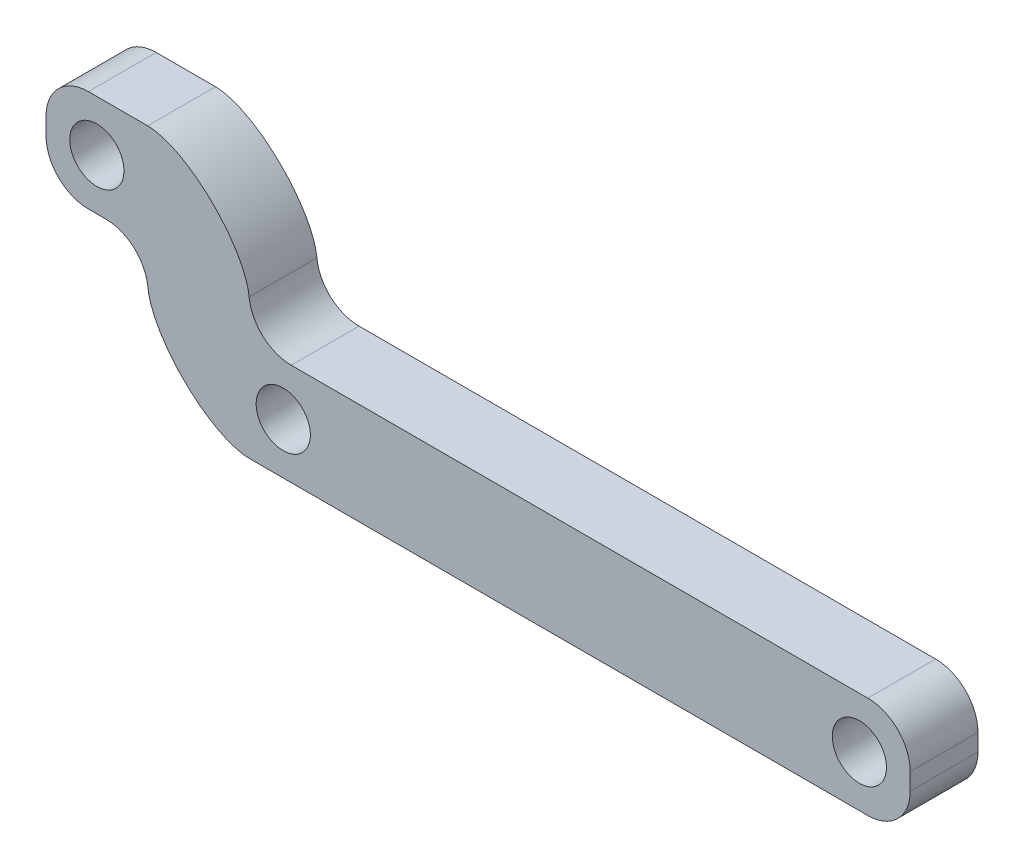
from build123d import *

# Parameters (mm, degrees)
SKETCH1_W           = 45
SKETCH1_H           = 6
SKETCH1_W_2         = 6
BOSS_EXTRUDE1_DEPTH = 4
SKETCH2_R           = 1.6
CUT_EXTRUDE1_DEPTH  = 52.778373864
FILLET2_SIZE        = 6
FILLET3_R           = 2.5


with BuildPart() as part:
    # Sketch1 → Boss-Extrude1 (new body)
    with BuildSketch(Plane.XY):
        with Locations((-22.5, -3)):
            Rectangle(SKETCH1_W, SKETCH1_H)
        Polygon((-45, 0), (-39, 0), (-39, 8), (-45, 8), (-45, 2), align=None)
        with Locations((-48, 5)):
            Rectangle(SKETCH1_W_2, SKETCH1_H)
    extrude(amount=BOSS_EXTRUDE1_DEPTH)

    # Sketch2 → Cut-Extrude1 (cut, through all)
    with BuildSketch(Plane(origin=(0, 0, 0), x_dir=(-1, 0, 0), z_dir=(0, 0, -1))):
        with Locations((3, -3)):
            Circle(SKETCH2_R)
        with Locations((37, -3)):
            Circle(SKETCH2_R)
        with Locations((48, 5)):
            Circle(SKETCH2_R)
    extrude(amount=-CUT_EXTRUDE1_DEPTH, mode=Mode.SUBTRACT)

    # Fillet2
    # a fillet whose section is not a circle: 6 mm, written as the material it takes off along each edge
    with BuildSketch(Plane(origin=(-45, -6, -15), x_dir=(1, 0, 0), z_dir=(0, 0, 1))) as fillet2_piece_1:
        with BuildLine():
            Bezier((FILLET2_SIZE, 0), (0, 0), (0, FILLET2_SIZE), weights=[1, 0.428571429, 1])
            Line((0, FILLET2_SIZE), (0, 0))
            Line((0, 0), (FILLET2_SIZE, 0))
        make_face()
    extrude(amount=34, mode=Mode.SUBTRACT)
    with BuildSketch(Plane(origin=(-39, 8, -15), x_dir=(0, -1, 0), z_dir=(0, 0, 1))) as fillet2_piece_2:
        with BuildLine():
            Bezier((FILLET2_SIZE, 0), (0, 0), (0, -FILLET2_SIZE), weights=[1, 0.428571429, 1])
            Line((0, -FILLET2_SIZE), (0, 0))
            Line((0, 0), (FILLET2_SIZE, 0))
        make_face()
    extrude(amount=34, mode=Mode.SUBTRACT)

    # Fillet3
    fillet3_edges = [part.edges().sort_by_distance(p)[0] for p in [
        (-51, 8, 2),
        (-51, 2, 2),
        (-45, 2, 2),
        (-39, 0, 2),
        (0, 0, 2),
        (0, -6, 2),
    ]]
    fillet(fillet3_edges, radius=FILLET3_R)


solid = part.part
